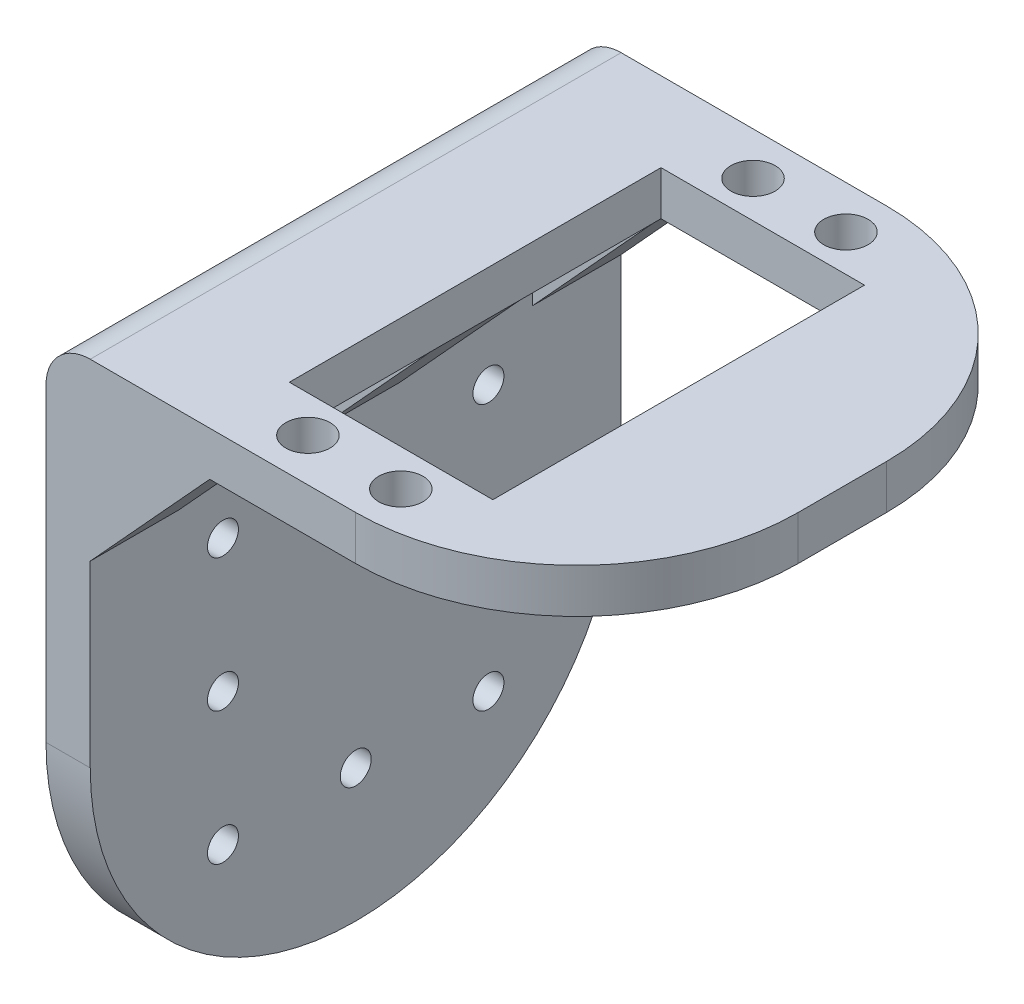
from build123d import *

# Parameters (mm, degrees)
BOSS_EXTRUDE1_DEPTH    = 5
CUT_EXTRUDE1_REACH     = 58.403
SKETCH2_R              = 1.75
SKETCH4_W              = 60
SKETCH4_H              = 60
BOSS_EXTRUDE2_DEPTH    = 5
CUT_EXTRUDE2_REACH     = 83.854
SKETCH3_R              = 2.5
SKETCH3_W              = 42
SKETCH3_H              = 23
FILLET1_R              = 25
FILLET2_R              = 5
FILLET3_R              = 2
BOSS_EXTRUDE3_DEPTH    = 5
LPATTERN1_COUNT        = 2
LPATTERN1_PITCH        = 25
LPATTERN2_COPY_1_DEPTH = 5
LPATTERN2_COPY_2_DEPTH = 5


with BuildPart() as part:
    # Sketch1 → Boss-Extrude1 (new body)
    with BuildSketch(Plane(origin=(0, 0, 0), x_dir=(0, 0, -1), z_dir=(1, 0, 0))):
        with BuildLine():
            ThreePointArc((-30, -17.5), (0, -47.5), (30, -17.5))
            Line((30, -17.5), (30, 17.5))
            Line((30, 17.5), (-30, 17.5))
            Line((-30, 17.5), (-30, -17.5))
        make_face()
    extrude(amount=BOSS_EXTRUDE1_DEPTH)

    # Sketch2 → Cut-Extrude1 (cut, up to next)
    with BuildSketch(Plane(origin=(5, 0, 0), x_dir=(0, 0, -1), z_dir=(1, 0, 0)), mode=Mode.PRIVATE) as cut_extrude1_sk1:
        with Locations((-15, -32.5)):
            Circle(SKETCH2_R)
    cut_extrude1_tool1 = extrude(cut_extrude1_sk1.sketch, amount=-CUT_EXTRUDE1_REACH, mode=Mode.PRIVATE) & part.part
    # Sketch2 → Cut-Extrude1 (cut, up to next)
    with BuildSketch(Plane(origin=(5, 0, 0), x_dir=(0, 0, -1), z_dir=(1, 0, 0)), mode=Mode.PRIVATE) as cut_extrude1_sk2:
        with Locations((15, -32.5)):
            Circle(SKETCH2_R)
    cut_extrude1_tool2 = extrude(cut_extrude1_sk2.sketch, amount=-CUT_EXTRUDE1_REACH, mode=Mode.PRIVATE) & part.part
    # Sketch2 → Cut-Extrude1 (cut, up to next)
    with BuildSketch(Plane(origin=(5, 0, 0), x_dir=(0, 0, -1), z_dir=(1, 0, 0)), mode=Mode.PRIVATE) as cut_extrude1_sk3:
        with Locations((-15, -2.5)):
            Circle(SKETCH2_R)
    cut_extrude1_tool3 = extrude(cut_extrude1_sk3.sketch, amount=-CUT_EXTRUDE1_REACH, mode=Mode.PRIVATE) & part.part
    # Sketch2 → Cut-Extrude1 (cut, up to next)
    with BuildSketch(Plane(origin=(5, 0, 0), x_dir=(0, 0, -1), z_dir=(1, 0, 0)), mode=Mode.PRIVATE) as cut_extrude1_sk4:
        with Locations((0, -2.5)):
            Circle(SKETCH2_R)
    cut_extrude1_tool4 = extrude(cut_extrude1_sk4.sketch, amount=-CUT_EXTRUDE1_REACH, mode=Mode.PRIVATE) & part.part
    # Sketch2 → Cut-Extrude1 (cut, up to next)
    with BuildSketch(Plane(origin=(5, 0, 0), x_dir=(0, 0, -1), z_dir=(1, 0, 0)), mode=Mode.PRIVATE) as cut_extrude1_sk5:
        with Locations((15, -2.5)):
            Circle(SKETCH2_R)
    cut_extrude1_tool5 = extrude(cut_extrude1_sk5.sketch, amount=-CUT_EXTRUDE1_REACH, mode=Mode.PRIVATE) & part.part
    # Sketch2 → Cut-Extrude1 (cut, up to next)
    with BuildSketch(Plane(origin=(5, 0, 0), x_dir=(0, 0, -1), z_dir=(1, 0, 0)), mode=Mode.PRIVATE) as cut_extrude1_sk6:
        with Locations((0, -32.5)):
            Circle(SKETCH2_R)
    cut_extrude1_tool6 = extrude(cut_extrude1_sk6.sketch, amount=-CUT_EXTRUDE1_REACH, mode=Mode.PRIVATE) & part.part
    # Sketch2 → Cut-Extrude1 (cut, up to next)
    with BuildSketch(Plane(origin=(5, 0, 0), x_dir=(0, 0, -1), z_dir=(1, 0, 0)), mode=Mode.PRIVATE) as cut_extrude1_sk7:
        with Locations((-15, -17.5)):
            Circle(SKETCH2_R)
    cut_extrude1_tool7 = extrude(cut_extrude1_sk7.sketch, amount=-CUT_EXTRUDE1_REACH, mode=Mode.PRIVATE) & part.part
    # Sketch2 → Cut-Extrude1 (cut, up to next)
    with BuildSketch(Plane(origin=(5, 0, 0), x_dir=(0, 0, -1), z_dir=(1, 0, 0)), mode=Mode.PRIVATE) as cut_extrude1_sk8:
        with Locations((15, -17.5)):
            Circle(SKETCH2_R)
    cut_extrude1_tool8 = extrude(cut_extrude1_sk8.sketch, amount=-CUT_EXTRUDE1_REACH, mode=Mode.PRIVATE) & part.part
    add(cut_extrude1_tool1.solids().sort_by_distance((5, -32.5, 15))[0], mode=Mode.SUBTRACT)
    add(cut_extrude1_tool2.solids().sort_by_distance((5, -32.5, -15))[0], mode=Mode.SUBTRACT)
    add(cut_extrude1_tool3.solids().sort_by_distance((5, -2.5, 15))[0], mode=Mode.SUBTRACT)
    add(cut_extrude1_tool4.solids().sort_by_distance((5, -2.5, 0))[0], mode=Mode.SUBTRACT)
    add(cut_extrude1_tool5.solids().sort_by_distance((5, -2.5, -15))[0], mode=Mode.SUBTRACT)
    add(cut_extrude1_tool6.solids().sort_by_distance((5, -32.5, 0))[0], mode=Mode.SUBTRACT)
    add(cut_extrude1_tool7.solids().sort_by_distance((5, -17.5, 15))[0], mode=Mode.SUBTRACT)
    add(cut_extrude1_tool8.solids().sort_by_distance((5, -17.5, -15))[0], mode=Mode.SUBTRACT)

    # Sketch4 → Boss-Extrude2 (add)
    with BuildSketch(Plane(origin=(0, 17.5, 0), x_dir=(1, 0, 0), z_dir=(0, 1, 0))):
        with Locations((30, 0)):
            Rectangle(SKETCH4_W, SKETCH4_H)
    extrude(amount=BOSS_EXTRUDE2_DEPTH)

    # Sketch3 → Cut-Extrude2 (cut, up to next)
    with BuildSketch(Plane(origin=(30, 22.5, 0), x_dir=(0, 0, -1), z_dir=(0, 1, 0)), mode=Mode.PRIVATE) as cut_extrude2_sk1:
        with Locations((25.15, 5.25)):
            Circle(SKETCH3_R)
    cut_extrude2_tool1 = extrude(cut_extrude2_sk1.sketch, amount=-CUT_EXTRUDE2_REACH, mode=Mode.PRIVATE) & part.part
    # Sketch3 → Cut-Extrude2 (cut, up to next)
    with BuildSketch(Plane(origin=(30, 22.5, 0), x_dir=(0, 0, -1), z_dir=(0, 1, 0)), mode=Mode.PRIVATE) as cut_extrude2_sk2:
        with Locations((25.15, -5.25)):
            Circle(SKETCH3_R)
    cut_extrude2_tool2 = extrude(cut_extrude2_sk2.sketch, amount=-CUT_EXTRUDE2_REACH, mode=Mode.PRIVATE) & part.part
    # Sketch3 → Cut-Extrude2 (cut, up to next)
    with BuildSketch(Plane(origin=(30, 22.5, 0), x_dir=(0, 0, -1), z_dir=(0, 1, 0)), mode=Mode.PRIVATE) as cut_extrude2_sk3:
        with Locations((-25.15, -5.25)):
            Circle(SKETCH3_R)
    cut_extrude2_tool3 = extrude(cut_extrude2_sk3.sketch, amount=-CUT_EXTRUDE2_REACH, mode=Mode.PRIVATE) & part.part
    # Sketch3 → Cut-Extrude2 (cut, up to next)
    with BuildSketch(Plane(origin=(30, 22.5, 0), x_dir=(0, 0, -1), z_dir=(0, 1, 0)), mode=Mode.PRIVATE) as cut_extrude2_sk4:
        with Locations((-25.15, 5.25)):
            Circle(SKETCH3_R)
    cut_extrude2_tool4 = extrude(cut_extrude2_sk4.sketch, amount=-CUT_EXTRUDE2_REACH, mode=Mode.PRIVATE) & part.part
    # Sketch3 → Cut-Extrude2 (cut, up to next)
    with BuildSketch(Plane(origin=(30, 22.5, 0), x_dir=(0, 0, -1), z_dir=(0, 1, 0)), mode=Mode.PRIVATE) as cut_extrude2_sk5:
        Rectangle(SKETCH3_W, SKETCH3_H)
    cut_extrude2_tool5 = extrude(cut_extrude2_sk5.sketch, amount=-CUT_EXTRUDE2_REACH, mode=Mode.PRIVATE) & part.part
    add(cut_extrude2_tool1.solids().sort_by_distance((24.75, 22.5, -25.15))[0], mode=Mode.SUBTRACT)
    add(cut_extrude2_tool2.solids().sort_by_distance((35.25, 22.5, -25.15))[0], mode=Mode.SUBTRACT)
    add(cut_extrude2_tool3.solids().sort_by_distance((35.25, 22.5, 25.15))[0], mode=Mode.SUBTRACT)
    add(cut_extrude2_tool4.solids().sort_by_distance((24.75, 22.5, 25.15))[0], mode=Mode.SUBTRACT)
    add(cut_extrude2_tool5.solids().sort_by_distance((30, 22.5, 0))[0], mode=Mode.SUBTRACT)

    # Fillet1
    fillet1_edges = [part.edges().sort_by_distance(p)[0] for p in [
        (60, 20, -30),
        (60, 20, 30),
    ]]
    fillet(fillet1_edges, radius=FILLET1_R)

    # Fillet2
    fillet2_edges = [part.edges().sort_by_distance(p)[0] for p in [
        (0, 22.5, 0),
    ]]
    fillet(fillet2_edges, radius=FILLET2_R)

    # Fillet3
    fillet3_edges = [part.edges().sort_by_distance(p)[0] for p in [
        (5, 17.5, 0),
    ]]
    fillet(fillet3_edges, radius=FILLET3_R)

    # Sketch6 → Boss-Extrude3 (add, symmetric)
    with BuildSketch(Plane.XY):
        Polygon((18.5, 17.5), (5, 2.743645437), (5, 17.5), align=None)
    boss_extrude3 = extrude(amount=BOSS_EXTRUDE3_DEPTH, both=True)

    # LPattern1: Boss-Extrude3 ×2
    with Locations(*[(0, 0, i * LPATTERN1_PITCH) for i in range(1, LPATTERN1_COUNT)]):
        add(boss_extrude3)

    # LPattern2 copy 1 sketch → LPattern2 copy 1 (add, symmetric)
    with BuildSketch(Plane.XY):
        Polygon((18.5, 17.5), (5, 2.743645437), (5, 17.5), align=None)
    extrude(amount=LPATTERN2_COPY_1_DEPTH, both=True)

    # LPattern2 copy 2 sketch → LPattern2 copy 2 (add, symmetric)
    with BuildSketch(Plane.XY.offset(-25)):
        Polygon((18.5, 17.5), (5, 2.743645437), (5, 17.5), align=None)
    extrude(amount=LPATTERN2_COPY_2_DEPTH, both=True)


solid = part.part
